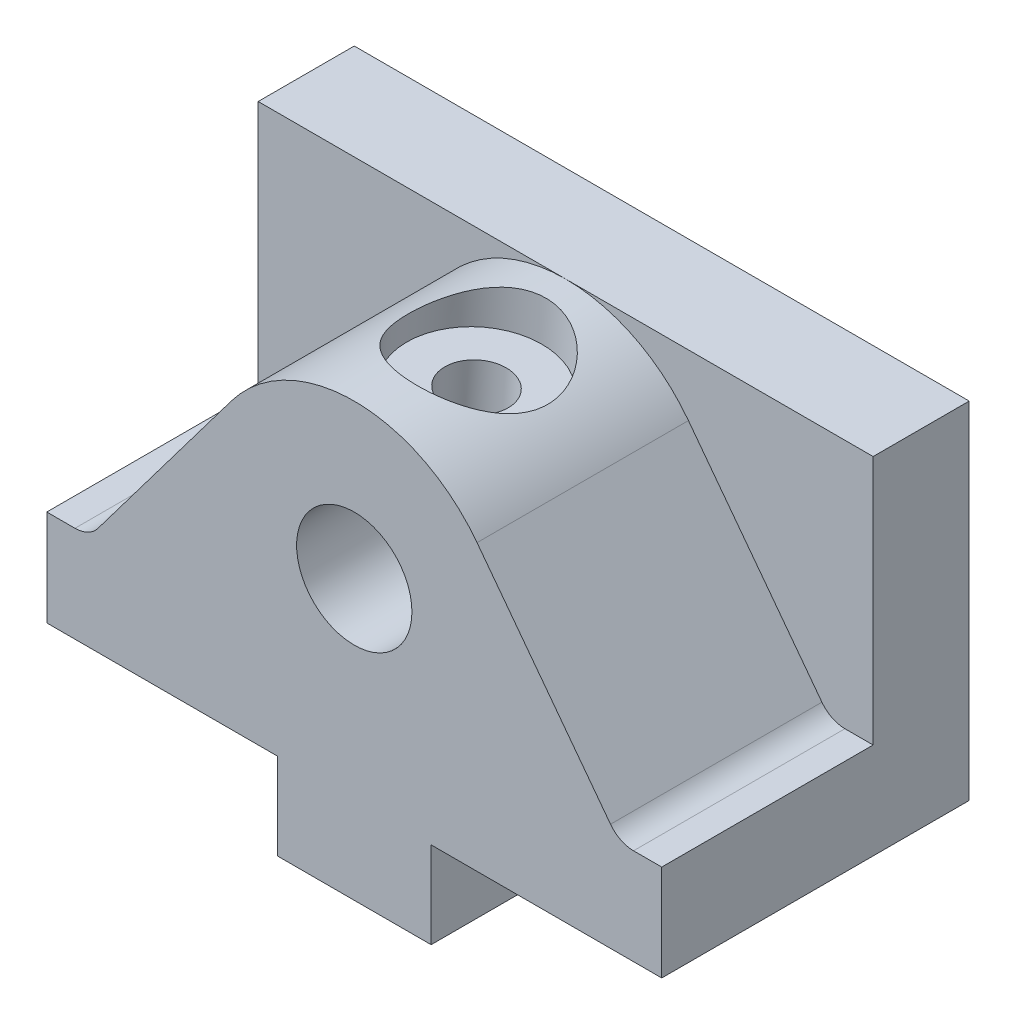
from build123d import *

# Parameters (mm, degrees)
EXTRUDE6_DEPTH               = 32
EXTRUDE13_DEPTH              = 22
SKETCH12_R                   = 6
EXTRUDE14_DEPTH              = 22
F_6_0_6_DIAMETER_HOLE1_D     = 6
F_6_0_6_DIAMETER_HOLE1_DEPTH = 16
F_6_0_6_DIAMETER_HOLE1_TIP   = 1.802581857


# Read off the part's stored shape, not the designer's step: CBORE for M6 Hex Head Bolt1
with BuildPart() as part:
    # Sketch8 → Extrude6 (new body)
    with BuildSketch(Plane.XY):
        Polygon((-78.603037361, 32.929005068), (-54.603037361, 32.929005068), (-54.603037361, 23.929005068), (-38.603037361, 23.929005068), (-38.603037361, 32.929005068), (-14.603037361, 32.929005068), (-14.603037361, 68.929005068), (-78.603037361, 68.929005068), align=None)
    extrude(amount=-EXTRUDE6_DEPTH)

    # Sketch9 → Extrude13 (cut)
    with BuildSketch(Plane.XY):
        with BuildLine():
            Line((-73.272586686, 44.123559999), (-59.381205522, 62.558045439))
            ThreePointArc((-59.381205522, 62.558045439), (-53.742202371, 67.247954854), (-46.603037361, 68.929005068))
            Line((-46.603037361, 68.929005068), (-78.603037361, 68.929005068))
            Line((-78.603037361, 68.929005068), (-78.603037361, 42.929005068))
            Line((-78.603037361, 42.929005068), (-75.668493217, 42.929005068))
            ThreePointArc((-75.668493217, 42.929005068), (-74.329899777, 43.244201983), (-73.272586686, 44.123559999))
        make_face()
        with BuildLine():
            Line((-14.603037361, 68.929005068), (-46.603037361, 68.929005068))
            ThreePointArc((-46.603037361, 68.929005068), (-39.463872351, 67.247954854), (-33.8248692, 62.558045439))
            Line((-33.8248692, 62.558045439), (-19.933488035, 44.123559999))
            ThreePointArc((-19.933488035, 44.123559999), (-18.876174944, 43.244201983), (-17.537581505, 42.929005068))
            Line((-17.537581505, 42.929005068), (-14.603037361, 42.929005068))
            Line((-14.603037361, 42.929005068), (-14.603037361, 68.929005068))
        make_face()
    extrude(amount=-EXTRUDE13_DEPTH, mode=Mode.SUBTRACT)

    # Sketch12 → Extrude14 (cut)
    with BuildSketch(Plane.XY):
        with Locations((-46.603037361, 52.929005068)):
            Circle(SKETCH12_R)
    extrude(amount=-EXTRUDE14_DEPTH, mode=Mode.SUBTRACT)

    # Ø6.0 (6) Diameter Hole1
    with Locations(Plane(origin=(-46.603037361, 23.929005068, -8), x_dir=(0, 0, -1), z_dir=(0, -1, 0))):
        with Locations((0, 0), (16, 0)):
            Hole(F_6_0_6_DIAMETER_HOLE1_D / 2, depth=F_6_0_6_DIAMETER_HOLE1_DEPTH)
            with Locations((0, 0, -(F_6_0_6_DIAMETER_HOLE1_DEPTH + F_6_0_6_DIAMETER_HOLE1_TIP / 2))):  # 118° drill point
                Cone(0, F_6_0_6_DIAMETER_HOLE1_D / 2, F_6_0_6_DIAMETER_HOLE1_TIP, mode=Mode.SUBTRACT)

    # CBORE for M6 Hex Head Bolt1 outline → CBORE for M6 Hex Head Bolt1 (revolve, cut)
    with BuildSketch(Plane(origin=(-49.700366285, 3.088627955, -12.000023726), x_dir=(0.9980745763174489, -0.06202531828813871, 0), z_dir=(0, 0, 1))):
        Polygon((0, 54.947204966), (3.3, 54.947204966), (3.3, 61.556526083), (7.275, 61.556526083), (7.275, 65.936761667), (0, 65.936761667), align=None)
    revolve(axis=Axis((-49.700366285, 3.088627955, -12.000023726), (0.062025318288138724, 0.9980745763174491, 0)), mode=Mode.SUBTRACT)


solid = part.part
